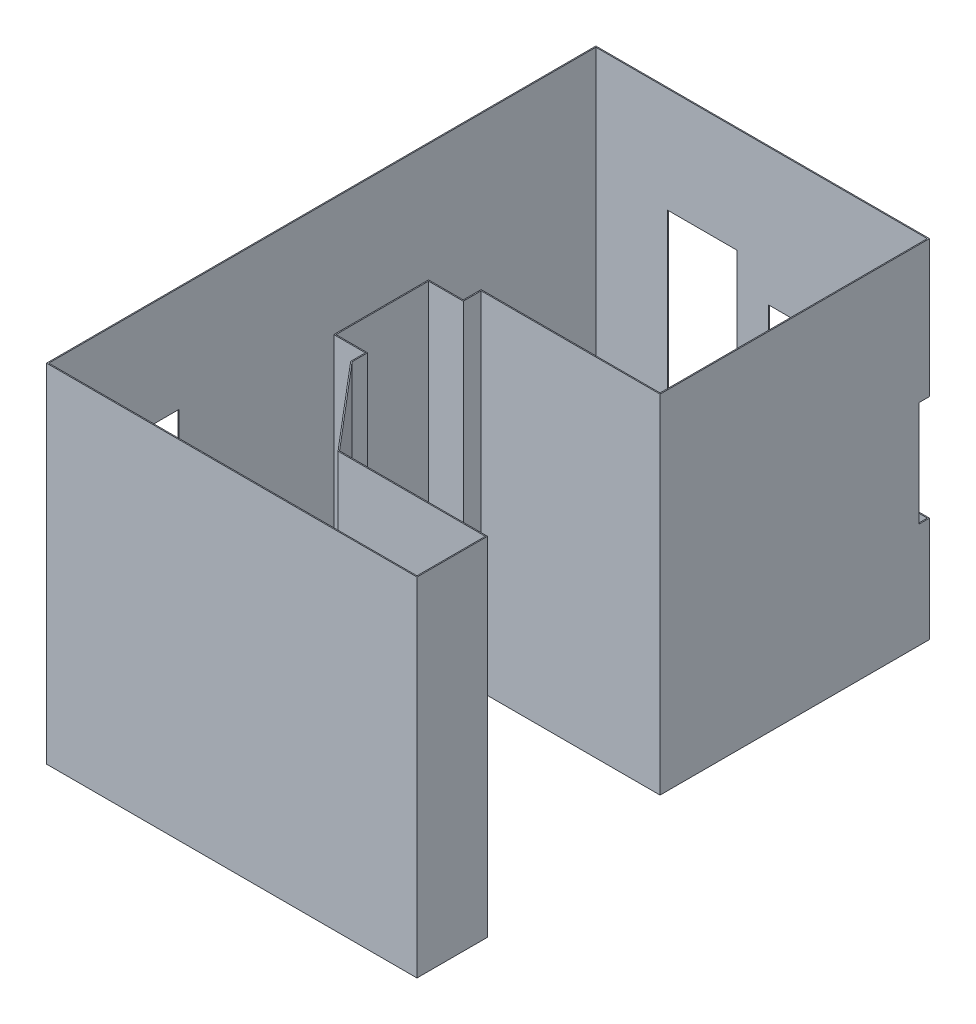
from build123d import *

# Parameters (mm, degrees)
EXTRUDE_2_DEPTH     = 330
SKETCH_2_W          = 66
SKETCH_2_H          = 220
SKETCH_2_W_2        = 154
SKETCH_2_H_2        = 100
CUT_EXTRUDE_1_DEPTH = 10
SKETCH_5_W          = 82
SKETCH_5_H          = 220
CUT_EXTRUDE_3_DEPTH = 10


with BuildPart() as part:
    # Эскиз1 → Вытянуть-Тонкостенный2 (new body)
    with BuildSketch(Plane(origin=(0, 0, 0), x_dir=(1, 0, 0), z_dir=(0, 1, 0))):
        Polygon((-34.007352544, 521), (-351, 521), (-351, -1), (1, -1), (1, 66), (-139.537591907, 66), (-207.007352544, 145.367607311), (-207.007352544, 160), (-237.007352544, 160), (-237.007352544, 248), (-204.007352544, 248), (-204.007352544, 265), (-34.007352544, 265), align=None)
        Polygon((-35.007352544, 520), (-350, 520), (-350, 0), (0, 0), (0, 65), (-140, 65), (-208.007352544, 145), (-208.007352544, 159), (-238.007352544, 159), (-238.007352544, 249), (-205.007352544, 249), (-205.007352544, 266), (-35.007352544, 266), align=None, mode=Mode.SUBTRACT)
    extrude(amount=EXTRUDE_2_DEPTH)

    # Эскиз2 → Вырез-Вытянуть1 (cut)
    with BuildSketch(Plane(origin=(0, 0, -521), x_dir=(-1, 0, 0), z_dir=(0, 0, -1))):
        with Locations((249, 120)):
            Rectangle(SKETCH_2_W, SKETCH_2_H)
        with Locations((109, 150)):
            Rectangle(SKETCH_2_W_2, SKETCH_2_H_2)
    extrude(amount=-CUT_EXTRUDE_1_DEPTH, mode=Mode.SUBTRACT)

    # Эскиз5 → Вырез-Вытянуть3 (cut)
    with BuildSketch(Plane.ZY.offset(351)):
        with Locations((-83, 120)):
            Rectangle(SKETCH_5_W, SKETCH_5_H)
    extrude(amount=-CUT_EXTRUDE_3_DEPTH, mode=Mode.SUBTRACT)


solid = part.part
